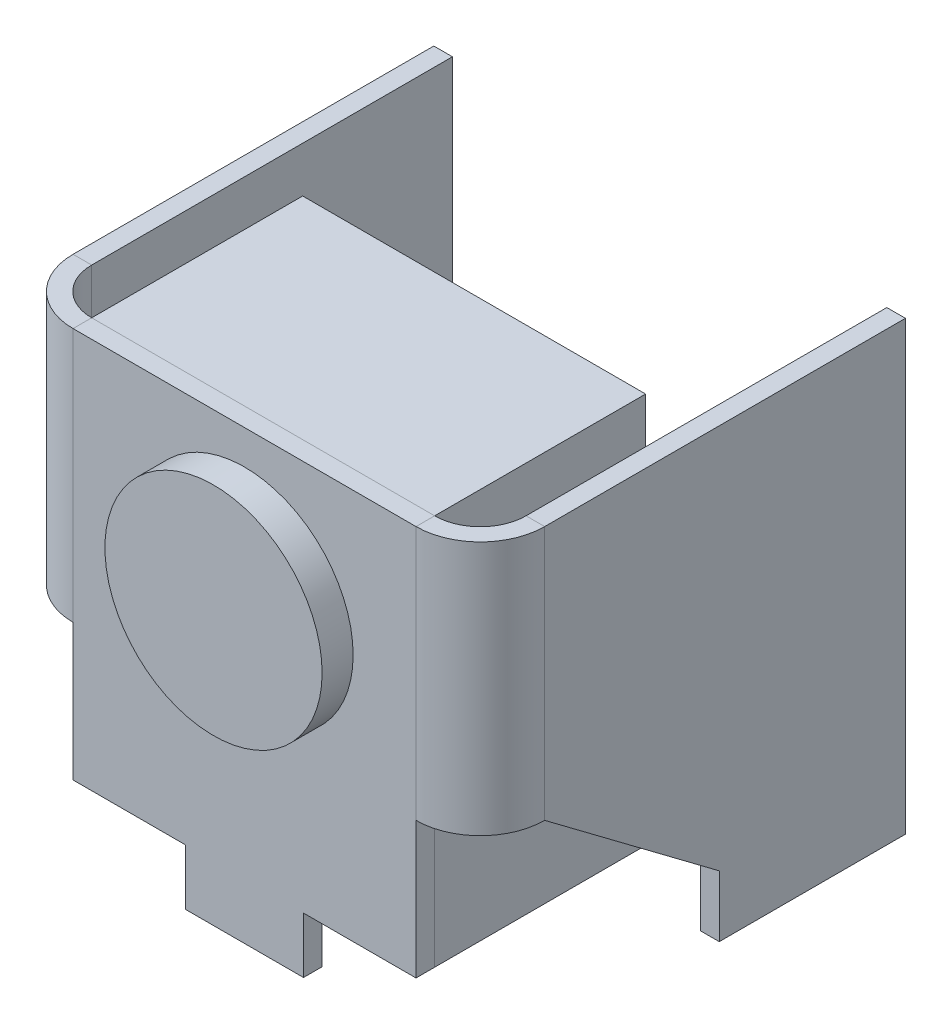
from build123d import *

# Parameters (mm, degrees)
SKETCH4_W                    = 3.8
SKETCH4_H                    = 7.2
BASE_FLANGE1_DEPTH           = 0.3
EDGE_FLANGE2_STRIP_W         = 2.6732
EDGE_FLANGE2_STRIP_H         = 0.3
EDGE_FLANGE2_STRIP_CUT_DEPTH = 7.2
EDGE_FLANGE2_DEPTH           = 7.2
SKETCH13_W                   = 1.8134
SKETCH13_H                   = 0.9
CUT_EXTRUDE1_DEPTH           = 0.3
CUT_EXTRUDE3_DEPTH           = 1.0366
SKETCH17_W                   = 5.5268
SKETCH17_H                   = 6.3
BOSS_EXTRUDE3_DEPTH          = 3.4
SKETCH18_R                   = 1.75
BOSS_EXTRUDE4_DEPTH          = 0.8


# Sheet-metal steps are written as plain solids
with BuildPart() as part:
    # Sketch4 → Base-Flange1 (new body)
    with BuildSketch(Plane.XY):
        with Locations((-1.9, 0)):
            Rectangle(SKETCH4_W, SKETCH4_H)
    extrude(amount=-BASE_FLANGE1_DEPTH)

    # Edge-Flange2 strip (across the edge) → Edge-Flange2 strip cut (cut)
    with BuildSketch(Plane(origin=(-3.8, -3.6, -0.3), x_dir=(1, 0, 0), z_dir=(0, 1, 0))):
        with Locations((-0.3, -0.15)):
            Rectangle(EDGE_FLANGE2_STRIP_W, EDGE_FLANGE2_STRIP_H)
    extrude(amount=EDGE_FLANGE2_STRIP_CUT_DEPTH, mode=Mode.SUBTRACT)

    # Edge-Flange2 section (across the edge) → Edge-Flange2 (add)
    with BuildSketch(Plane(origin=(-3.8, -3.6, -0.3), x_dir=(1, 0, 0), z_dir=(0, 1, 0))):
        with BuildLine():
            Line((0, 0.7366), (0, 6.55))
            Line((0, 6.55), (0.3, 6.55))
            Line((0.3, 6.55), (0.3, 0.7366))
            ThreePointArc((0.3, 0.7366), (0.515745145, 0.215745145), (1.0366, 0))
            Line((1.0366, 0), (1.0366, -0.3))
            ThreePointArc((1.0366, -0.3), (0.303613111, 0.003613111), (0, 0.7366))
        make_face()
    extrude(amount=EDGE_FLANGE2_DEPTH)

    # Sketch13 → Cut-Extrude1 (cut)
    with BuildSketch(Plane.XY):
        with Locations((-1.8567, -3.15)):
            Rectangle(SKETCH13_W, SKETCH13_H)
    extrude(amount=-CUT_EXTRUDE1_DEPTH, mode=Mode.SUBTRACT)

    # Sketch14 → Cut-Extrude3 (cut)
    with BuildSketch(Plane.ZY.offset(3.8)):
        Polygon((0, -0.5), (0, -3.6), (-3.85, -3.6), (-3.85, -2.611331844), (-1.0366, -0.5), align=None)
    extrude(amount=-CUT_EXTRUDE3_DEPTH, mode=Mode.SUBTRACT)

    # Mirror3: part across plane


with BuildPart() as part_1:
    add(part.part)
    add(part.part.mirror(Plane(origin=(0, -3.6, -0.3), x_dir=(0, 0, 1), z_dir=(1, 0, 0))))


with BuildPart() as body_2:
    # Sketch17 → Boss-Extrude3 (new body)
    with BuildSketch(Plane(origin=(0, 0, -0.3), x_dir=(-1, 0, 0), z_dir=(0, 0, -1))):
        with Locations((0, 0.45)):
            Rectangle(SKETCH17_W, SKETCH17_H)
    extrude(amount=BOSS_EXTRUDE3_DEPTH)

    # Sketch18 → Boss-Extrude4 (add)
    with BuildSketch(Plane.XY.offset(-0.3)):
        with Locations((0, 1.3)):
            Circle(SKETCH18_R)
    extrude(amount=BOSS_EXTRUDE4_DEPTH)


solid = Compound([part_1.part, body_2.part])
